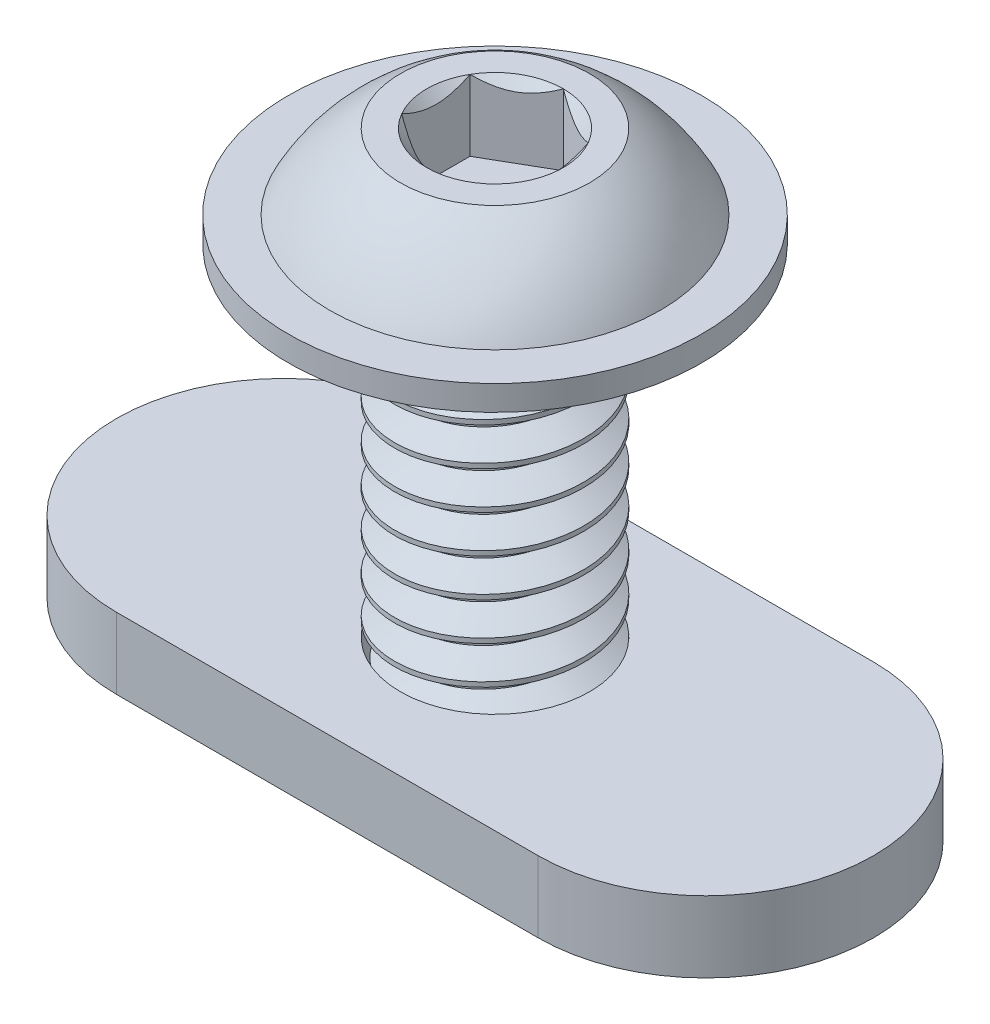
from build123d import *

# Parameters (mm, degrees)
SKETCH1_R           = 3.175
BOSS_EXTRUDE1_DEPTH = 12.7
CUT_SWEEP1_PITCH    = 1.27
SKETCH4_OUTSIDE_W   = 14
SKETCH4_OUTSIDE_H   = 14
SKETCH4_OUTSIDE_R   = 2.21262927
CUT_EXTRUDE1_DEPTH  = 1.27
CUT_EXTRUDE1_DRAFT  = -45
CUT_EXTRUDE2_DEPTH  = 2.38125
BOSS_EXTRUDE2_START = -11.43
SKETCH8_R           = 3.175
BOSS_EXTRUDE2_DEPTH = 2.3876
SKETCH9_R           = 3.5687
SKETCH9_R_2         = 3.175
BOSS_EXTRUDE3_DEPTH = 0.762


with BuildPart() as part:
    # Sketch1 → Boss-Extrude1 (new body)
    with BuildSketch(Plane(origin=(0, 0, 0), x_dir=(1, 0, 0), z_dir=(0, 1, 0))):
        with Locations(Location((0, 0, 0), (0, 0, 270))):
            Circle(SKETCH1_R)
    extrude(amount=-BOSS_EXTRUDE1_DEPTH)

    # Cut-Sweep1: the profile of Sketch3 screwed along a right-hand helix of 11 turns, 8 arcs to a turn; built about Z, then put on its axis
    cut_sweep1_z = Axis((0, 0, 0), (0, 0, 1))
    cut_sweep1_corners = [(2.350110803, 0, -0.47625), (3.243740766, 0, 0.0396875), (3.243740766, 0, -1.1509375), (2.350110803, 0, -0.635)]
    with BuildLine(mode=Mode.PRIVATE) as cut_sweep1_profile:
        Line(cut_sweep1_corners[0], cut_sweep1_corners[1])
        Line(cut_sweep1_corners[1], cut_sweep1_corners[2])
        Line(cut_sweep1_corners[2], cut_sweep1_corners[3])
        Line(cut_sweep1_corners[3], cut_sweep1_corners[0])
    cut_sweep1_cap = Face(cut_sweep1_profile.wire())
    cut_sweep1_turn_angles = [0, 22.5, 45, 67.5, 90, 112.5, 135, 157.5, 180, 202.5, 225, 247.5, 270, 292.5, 315, 337.5, 360]
    cut_sweep1_turn_weights = [1, 0.9238795325112867, 1, 0.9238795325112867, 1, 0.9238795325112867, 1, 0.9238795325112867, 1, 0.9238795325112867, 1, 0.9238795325112867, 1, 0.9238795325112867, 1, 0.9238795325112867, 1]
    cut_sweep1_turn_rails = [Edge.make_bspline([Vector(p[0], p[1], 0).rotate(cut_sweep1_z, cut_sweep1_turn_angles[k]) / cut_sweep1_turn_weights[k] + Vector(0, 0, p[2] + CUT_SWEEP1_PITCH * cut_sweep1_turn_angles[k] / 360) for k in range(17)], [0, 0, 0, 1, 1, 2, 2, 3, 3, 4, 4, 5, 5, 6, 6, 7, 7, 8, 8, 8], 2, cut_sweep1_turn_weights) for p in cut_sweep1_corners]
    cut_sweep1_turn_sides = [Face.make_surface_from_curves(cut_sweep1_turn_rails[p[0]], cut_sweep1_turn_rails[p[1]]) for p in [(0, 1), (1, 2), (2, 3), (3, 0)]]
    cut_sweep1 = Plane(origin=(0, -12.7, 0), x_dir=(0, 0, -1), z_dir=(0, 1, 0)) * Solid(Shell([*[p.moved(Location((0, 0, CUT_SWEEP1_PITCH * i))) for i in range(11) for p in cut_sweep1_turn_sides], cut_sweep1_cap, cut_sweep1_cap.rotate(cut_sweep1_z, 3960).moved(Location((0, 0, CUT_SWEEP1_PITCH * 3960 / 360)))]))
    add(cut_sweep1, mode=Mode.SUBTRACT)


with BuildPart() as cut_extrude1_tool:
    # Sketch4 outside → Cut-Extrude1 (with draft: the straight prism first)
    with BuildSketch(Plane.XZ.offset(12.7)):
        Rectangle(SKETCH4_OUTSIDE_W, SKETCH4_OUTSIDE_H)
        Circle(SKETCH4_OUTSIDE_R, mode=Mode.SUBTRACT)
    extrude(amount=-CUT_EXTRUDE1_DEPTH)
    # Cut-Extrude1: the draft: its side faces are tilted about the plane it starts from
    cut_extrude1_sides = [cut_extrude1_tool.faces().sort_by_distance(p)[0] for p in [
        (0, -12.065, -7),
        (7, -12.065, 0),
        (0, -12.065, 7),
        (-7, -12.065, 0),
        (-2.21262927, -12.065, 0),
    ]]
    draft(cut_extrude1_sides, Plane.XZ.offset(12.7), CUT_EXTRUDE1_DRAFT)


with BuildPart() as part_1:
    add(part.part)

    # Cut-Extrude1: cut by cut_extrude1_tool
    add(cut_extrude1_tool.part, mode=Mode.SUBTRACT)

    # Sketch5 → Revolve1 (revolve)
    with BuildSketch(Plane.XY, mode=Mode.PRIVATE) as revolve1_sk:
        with BuildLine():
            Line((0, 0), (0, 3.3528))
            Line((0, 3.3528), (-3.175, 3.3528))
            ThreePointArc((-3.175, 3.3528), (-4.540019085, 2.263204136), (-5.5499, 0.8382))
            Line((-5.5499, 0.8382), (-6.9342, 0.8382))
            Line((-6.9342, 0.8382), (-6.9342, 0))
            Line((-6.9342, 0), (0, 0))
        make_face()
    revolve(revolve1_sk.sketch.rotate(Axis((0, 0, 0), (0, 1, 0)), 270), axis=Axis((0, 0, 0), (0, 1, 0)))

    # Sketch6 → Cut-Extrude2 (cut)
    with BuildSketch(Plane(origin=(0, 3.3528, 0), x_dir=(1, 0, 0), z_dir=(0, 1, 0))):
        Polygon((0, 2.291358881), (-1.984375, 1.14567944), (-1.984375, -1.14567944), (0, -2.291358881), (1.984375, -1.14567944), (1.984375, 1.14567944), align=None)
    extrude(amount=-CUT_EXTRUDE2_DEPTH, mode=Mode.SUBTRACT)

    # Cut-Extrude3 cone 1 section (through the dimple's axis) → Cut-Extrude3 (revolve, cut)
    with BuildSketch(Plane(origin=(0, 3.3528, 0), x_dir=(0, 0, 1), z_dir=(1, 0, 0))):
        Polygon((0, 0), (2.291358881, 0), (0, 2.291358881), align=None)
    revolve(axis=Axis((0, 3.3528, 0), (0, -1, 0)), mode=Mode.SUBTRACT)


with BuildPart() as body_2:
    # Sketch8 → Boss-Extrude2 (new body)
    with BuildSketch(Plane(origin=(0, 0, 0), x_dir=(1, 0, 0), z_dir=(0, 1, 0)).offset(BOSS_EXTRUDE2_START)):
        with BuildLine():
            Line((-7.0739, 5.6261), (7.0739, 5.6261))
            ThreePointArc((7.0739, 5.6261), (12.7, 0), (7.0739, -5.6261))
            Line((7.0739, -5.6261), (-7.0739, -5.6261))
            ThreePointArc((-7.0739, -5.6261), (-12.7, 0), (-7.0739, 5.6261))
        make_face()
        with Locations(Location((0, 0, 0), (0, 0, 270))):
            Circle(SKETCH8_R, mode=Mode.SUBTRACT)
    extrude(amount=-BOSS_EXTRUDE2_DEPTH)

    # Sketch9 → Boss-Extrude3 (add)
    with BuildSketch(Plane.XZ.offset(13.8176)):
        with Locations(Location((0, 0, 0), (0, 0, 90))):
            Circle(SKETCH9_R)
        with Locations(Location((0, 0, 0), (0, 0, 90))):
            Circle(SKETCH9_R_2, mode=Mode.SUBTRACT)
    extrude(amount=BOSS_EXTRUDE3_DEPTH)


solid = Compound([part_1.part, body_2.part])
